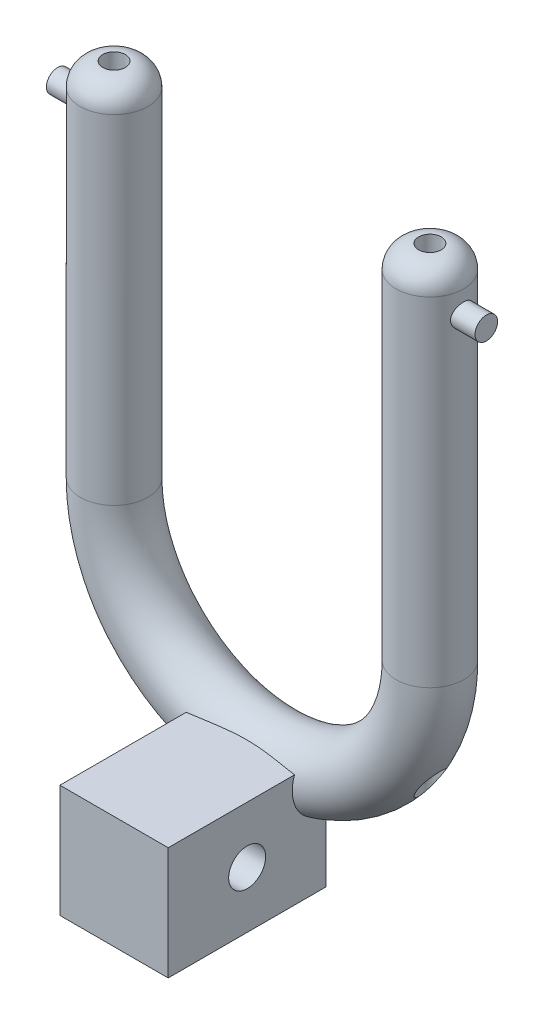
from build123d import *

# Parameters (mm, degrees)
SWEEP1_PROFILE_R        = 7.5
SKETCH7_W               = 24
SKETCH7_H               = 25
BOSS_EXTRUDE1_DEPTH     = 35
SKETCH8_R               = 4.1
CUT_EXTRUDE1_DEPTH      = 103.933230873
CUT_EXTRUDE2_DEPTH      = 133.001873463
CUT_EXTRUDE2_DEPTH_BACK = 133.001873463
SKETCH9_R               = 2.5
BOSS_EXTRUDE2_START     = 41.5
SKETCH11_R              = 2.5
BOSS_EXTRUDE2_DEPTH     = 6
BOSS_EXTRUDE3_START     = -41.5
SKETCH11_2_R            = 2.5
BOSS_EXTRUDE3_DEPTH     = 6
FILLET1_R               = 5


with BuildPart() as part:
    # Sweep1: sweep along a path in Sketch1
    with BuildLine(Plane.XY) as sweep1_path:
        Line((-91.492396531, 80), (-91.492396531, 0))
        ThreePointArc((-91.492396531, 0), (-56.492396531, -35), (-21.492396531, 0))
        Line((-21.492396531, 0), (-21.492396531, 80))
    # Sweep1 profile (on start of the path) → Sweep1 (sweep)
    with BuildSketch(Plane(origin=(-91.492396531, 80, 0), x_dir=(0, 0, -1), z_dir=(0, -1, 0))):
        Circle(SWEEP1_PROFILE_R)
    sweep(path=sweep1_path.line)

    # Sketch7 → Boss-Extrude1 (add)
    with BuildSketch(Plane.XY):
        with Locations((-56.492396531, -42.5)):
            Rectangle(SKETCH7_W, SKETCH7_H)
    extrude(amount=BOSS_EXTRUDE1_DEPTH)

    # Sketch8 → Cut-Extrude1 (cut, through all)
    with BuildSketch(Plane(origin=(-44.492396531, 0, 0), x_dir=(0, 0, -1), z_dir=(1, 0, 0))):
        with Locations((-17.5, -42.5)):
            Circle(SKETCH8_R)
    extrude(amount=-CUT_EXTRUDE1_DEPTH, mode=Mode.SUBTRACT)

    # Sketch9 → Cut-Extrude2 (cut, two sides: drawn at the far end of the back side and taken through both)
    with BuildSketch(Plane(origin=(0, 0, 0), x_dir=(1, 0, 0), z_dir=(0, 1, 0)).offset(-CUT_EXTRUDE2_DEPTH_BACK)):
        with Locations(Location((-91.492396531, 0, 0), (0, 0, 270))):
            Circle(SKETCH9_R)
        with Locations(Location((-21.492396531, 0, 0), (0, 0, 270))):
            Circle(SKETCH9_R)
    extrude(amount=CUT_EXTRUDE2_DEPTH + CUT_EXTRUDE2_DEPTH_BACK, mode=Mode.SUBTRACT)

    # Fillet1
    fillet1_edges = [part.edges().sort_by_distance(p)[0] for p in [
        (-21.492396531, 80, 7.5),
        (-91.492396531, 80, 7.5),
    ]]
    fillet(fillet1_edges, radius=FILLET1_R - 0.0001)  # a hair under: the kernel refuses the full size


with BuildPart() as body_2:
    # Sketch11 → Boss-Extrude2 (new body)
    with BuildSketch(Plane(origin=(-56.492396531, 0, 0), x_dir=(0, 0, -1), z_dir=(1, 0, 0)).offset(BOSS_EXTRUDE2_START)):
        with Locations((0, 70)):
            Circle(SKETCH11_R)
    extrude(amount=BOSS_EXTRUDE2_DEPTH)


with BuildPart() as body_3:
    # Sketch11<2> → Boss-Extrude3 (new body)
    with BuildSketch(Plane(origin=(-56.492396531, 0, 0), x_dir=(0, 0, -1), z_dir=(1, 0, 0)).offset(BOSS_EXTRUDE3_START)):
        with Locations((0, 70)):
            Circle(SKETCH11_2_R)
    extrude(amount=-BOSS_EXTRUDE3_DEPTH)


solid = Compound([part.part, body_2.part, body_3.part])
